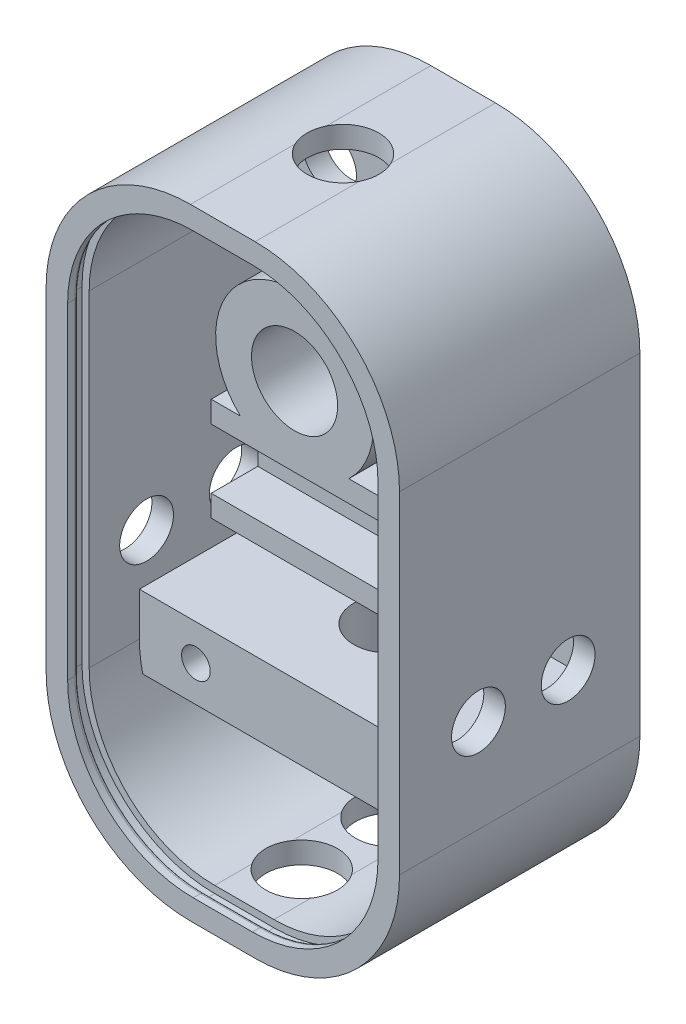
from build123d import *

# Parameters (mm, degrees)
SKIZZE2_W                            = 19.7
SKIZZE2_H                            = 34.6
SKIZZE2_W_2                          = 17.3
SKIZZE2_H_2                          = 32.2
LINEAR_AUSTRAGEN_D_NN1_DEPTH         = 13.4
VERRUNDUNG1_R                        = 7
VERRUNDUNG2_R                        = 8.05
AUFSATZ_LINEAR_START                 = -1.2
AUFSATZ_LINEAR_AUSTRAGEN2_DEPTH      = 1.2
SKIZZE6_R                            = 2
SCHNITT_LINEAR_AUSTRAGEN2_DEPTH      = 2
SKIZZE7_W                            = 18.44
SKIZZE7_H                            = 5.74
SKIZZE7_W_2                          = 16.04
SKIZZE7_H_2                          = 3.34
LINEAR_AUSTRAGEN_D_NN2_DEPTH         = 8.2
SKIZZE8_W                            = 16.04
SKIZZE8_H                            = 3.34
AUFSATZ_LINEAR_AUSTRAGEN3_DEPTH      = 5.6
SKIZZE10_W                           = 13.935
SKIZZE10_H                           = 1.235
SCHNITT_LINEAR_AUSTRAGEN3_DEPTH      = 15.5
SKIZZE11_W                           = 13.935
SKIZZE11_H                           = 1.235
AUFSATZ_LINEAR_AUSTRAGEN4_DEPTH      = 1.2
SKIZZE13_W                           = 17.3
SKIZZE13_H                           = 4
AUFSATZ_LINEAR_AUSTRAGEN6_DEPTH      = 8.2
SKIZZE14_R                           = 0.8
SCHNITT_LINEAR_AUSTRAGEN4_DEPTH      = 8.2
SKIZZE19_R                           = 1.5
SCHNITT_LINEAR_AUSTRAGEN5_DEPTH      = 25.4
SKIZZE20_R                           = 2
SCHNITT_LINEAR_AUSTRAGEN6_DEPTH      = 5.4
SKIZZE21_R                           = 1.5
SCHNITT_LINEAR_AUSTRAGEN7_DEPTH      = 5.4
SKIZZE22_R                           = 1.5
SCHNITT_LINEAR_AUSTRAGEN8_DEPTH      = 5.4
SKIZZE24_R                           = 4.4
SKIZZE24_R_2                         = 2.4
LINEAR_AUSTRAGEN_D_NN3_DEPTH         = 8.2
SKIZZE25_R                           = 2
SCHNITT_LINEAR_AUSTRAGEN9_DEPTH      = 4
VERRUNDUNG3_R                        = 0.6
VERRUNDUNG4_R                        = 0.6
VERRUNDUNG5_R                        = 0.6
SCHNITT_LINEAR_AUSTRAGEN_D_NN1_DEPTH = 1.2
LINEAR_AUSTRAGEN_D_NN4_DEPTH         = 0.6
VERRUNDUNG6_R                        = 0.2
SCHNITT_LINEAR_AUSTRAGEN12_DEPTH     = 6


with BuildPart() as part:
    # Skizze2 → Linear-Austragen-Dünn1 (new body)
    with BuildSketch(Plane.XY):
        with Locations((0, 4.05)):
            Rectangle(SKIZZE2_W, SKIZZE2_H)
        with Locations((0, 4.05)):
            Rectangle(SKIZZE2_W_2, SKIZZE2_H_2, mode=Mode.SUBTRACT)
    extrude(amount=LINEAR_AUSTRAGEN_D_NN1_DEPTH)

    # Verrundung1
    verrundung1_edges = [part.edges().sort_by_distance(p)[0] for p in [
        (8.65, -12.05, 6.7),
        (-8.65, -12.05, 6.7),
        (-8.65, 20.15, 6.7),
        (8.65, 20.15, 6.7),
    ]]
    fillet(verrundung1_edges, radius=VERRUNDUNG1_R)

    # Verrundung2
    verrundung2_edges = [part.edges().sort_by_distance(p)[0] for p in [
        (-9.85, -13.25, 6.7),
        (9.85, -13.25, 6.7),
        (9.85, 21.35, 6.7),
        (-9.85, 21.35, 6.7),
    ]]
    fillet(verrundung2_edges, radius=VERRUNDUNG2_R)

    # Skizze4 → Aufsatz-Linear austragen2 (add)
    with BuildSketch(Plane(origin=(0, 0, 0), x_dir=(-1, 0, 0), z_dir=(0, 0, -1)).offset(AUFSATZ_LINEAR_START)):
        with BuildLine():
            Line((1.65, -12.05), (-1.65, -12.05))
            ThreePointArc((-1.65, -12.05), (-6.599747468, -9.999747468), (-8.65, -5.05))
            Line((-8.65, -5.05), (-8.65, 13.15))
            ThreePointArc((-8.65, 13.15), (-6.599747468, 18.099747468), (-1.65, 20.15))
            Line((-1.65, 20.15), (1.65, 20.15))
            ThreePointArc((1.65, 20.15), (6.599747468, 18.099747468), (8.65, 13.15))
            Line((8.65, 13.15), (8.65, -5.05))
            ThreePointArc((8.65, -5.05), (6.599747468, -9.999747468), (1.65, -12.05))
        make_face()
    extrude(amount=AUFSATZ_LINEAR_AUSTRAGEN2_DEPTH)

    # Skizze6 → Schnitt-Linear austragen2 (cut)
    with BuildSketch(Plane(origin=(0, 21.35, 0), x_dir=(1, 0, 0), z_dir=(0, 1, 0))):
        with Locations((0, -6.7)):
            Circle(SKIZZE6_R)
    extrude(amount=-SCHNITT_LINEAR_AUSTRAGEN2_DEPTH, mode=Mode.SUBTRACT)

    # Skizze7 → Linear-Austragen-Dünn2 (add)
    with BuildSketch(Plane.XY.offset(1.2)):
        with Locations((0, 5.65)):
            Rectangle(SKIZZE7_W, SKIZZE7_H)
        with Locations((0, 5.65)):
            Rectangle(SKIZZE7_W_2, SKIZZE7_H_2, mode=Mode.SUBTRACT)
    extrude(amount=LINEAR_AUSTRAGEN_D_NN2_DEPTH)

    # Skizze8 → Aufsatz-Linear austragen3 (add)
    with BuildSketch(Plane.XY.offset(1.2)):
        with Locations((0, 5.65)):
            Rectangle(SKIZZE8_W, SKIZZE8_H)
    extrude(amount=AUFSATZ_LINEAR_AUSTRAGEN3_DEPTH)

    # Skizze10 → Schnitt-Linear austragen3 (cut)
    with BuildSketch(Plane.XY):
        with Locations((0, 5.65)):
            Rectangle(SKIZZE10_W, SKIZZE10_H)
    extrude(amount=SCHNITT_LINEAR_AUSTRAGEN3_DEPTH, mode=Mode.SUBTRACT)

    # Skizze11 → Aufsatz-Linear austragen4 (add)
    with BuildSketch(Plane(origin=(0, 0, 0), x_dir=(-1, 0, 0), z_dir=(0, 0, -1))):
        with Locations((0, 5.65)):
            Rectangle(SKIZZE11_W, SKIZZE11_H)
    extrude(amount=-AUFSATZ_LINEAR_AUSTRAGEN4_DEPTH)

    # Skizze13 → Aufsatz-Linear austragen6 (add)
    with BuildSketch(Plane.XY.offset(1.2)):
        with Locations((0, -4.65)):
            Rectangle(SKIZZE13_W, SKIZZE13_H)
    extrude(amount=AUFSATZ_LINEAR_AUSTRAGEN6_DEPTH)

    # Skizze14 → Schnitt-Linear austragen4 (cut)
    with BuildSketch(Plane.XY.offset(9.4)):
        with Locations((-5.5, -4.65)):
            Circle(SKIZZE14_R)
        with Locations((5.5, -4.65)):
            Circle(SKIZZE14_R)
    extrude(amount=-SCHNITT_LINEAR_AUSTRAGEN4_DEPTH, mode=Mode.SUBTRACT)

    # Skizze19 → Schnitt-Linear austragen5 (cut)
    with BuildSketch(Plane(origin=(9.85, 0, 0), x_dir=(0, 0, -1), z_dir=(1, 0, 0))):
        with Locations((-4, 0)):
            Circle(SKIZZE19_R)
        with Locations((-9, 0)):
            Circle(SKIZZE19_R)
    extrude(amount=-SCHNITT_LINEAR_AUSTRAGEN5_DEPTH, mode=Mode.SUBTRACT)

    # Skizze20 → Schnitt-Linear austragen6 (cut)
    with BuildSketch(Plane.XZ.offset(13.25)):
        with Locations((0, 4)):
            Circle(SKIZZE20_R)
        with Locations((0, 9)):
            Circle(SKIZZE20_R)
    extrude(amount=-SCHNITT_LINEAR_AUSTRAGEN6_DEPTH, mode=Mode.SUBTRACT)

    # Skizze21 → Schnitt-Linear austragen7 (cut)
    with BuildSketch(Plane.XY.offset(1.2)):
        with Locations((-3.65, 0.18)):
            Circle(SKIZZE21_R)
        with Locations((3.65, 0.18)):
            Circle(SKIZZE21_R)
        with Locations((3.65, -9.05)):
            Circle(SKIZZE21_R)
        with Locations((-3.65, -9.05)):
            Circle(SKIZZE21_R)
    extrude(amount=-SCHNITT_LINEAR_AUSTRAGEN7_DEPTH, mode=Mode.SUBTRACT)

    # Skizze22 → Schnitt-Linear austragen8 (cut)
    with BuildSketch(Plane.XY.offset(1.2)):
        with Locations((-6.25, 15.15)):
            Circle(SKIZZE22_R)
        with Locations((6.25, 15.15)):
            Circle(SKIZZE22_R)
    extrude(amount=-SCHNITT_LINEAR_AUSTRAGEN8_DEPTH, mode=Mode.SUBTRACT)

    # Skizze24 → Linear-Austragen-Dünn3 (add)
    with BuildSketch(Plane.XY.offset(1.2)):
        with Locations((0, 11.72)):
            Circle(SKIZZE24_R)
        with Locations((0, 11.72)):
            Circle(SKIZZE24_R_2, mode=Mode.SUBTRACT)
    extrude(amount=LINEAR_AUSTRAGEN_D_NN3_DEPTH)

    # Skizze25 → Schnitt-Linear austragen9 (cut)
    with BuildSketch(Plane.XZ.offset(6.65)):
        with Locations((0, 4.1)):
            Circle(SKIZZE25_R)
    extrude(amount=-SCHNITT_LINEAR_AUSTRAGEN9_DEPTH, mode=Mode.SUBTRACT)

    # Verrundung3
    verrundung3_edges = [part.edges().sort_by_distance(p)[0] for p in [
        (8.65, 10.835, 1.2),
        (-8.65, 10.835, 1.2),
        (6.599747468, 18.099747468, 1.2),
        (0, 20.15, 1.2),
        (-6.599747468, 18.099747468, 1.2),
    ]]
    fillet(verrundung3_edges, radius=VERRUNDUNG3_R)

    # Verrundung4
    verrundung4_edges = [part.edges().sort_by_distance(p)[0] for p in [
        (8.65, 0.065, 1.2),
        (-8.65, 0.065, 1.2),
    ]]
    fillet(verrundung4_edges, radius=VERRUNDUNG4_R)

    # Verrundung5
    verrundung5_edges = [part.edges().sort_by_distance(p)[0] for p in [
        (-5.997413024, -10.53634669, 1.2),
        (0, -12.05, 1.2),
        (5.997413024, -10.53634669, 1.2),
    ]]
    fillet(verrundung5_edges, radius=VERRUNDUNG5_R)

    # Skizze28 → Schnitt-Linear-Austragen-Dünn1 (cut)
    with BuildSketch(Plane.XY.offset(13.4)):
        with BuildLine():
            Line((-9.05, 13.15), (-9.05, -5.05))
            ThreePointArc((-9.05, -5.05), (-6.882590181, -10.282590181), (-1.65, -12.45))
            Line((-1.65, -12.45), (1.65, -12.45))
            ThreePointArc((1.65, -12.45), (6.882590181, -10.282590181), (9.05, -5.05))
            Line((9.05, -5.05), (9.05, 13.15))
            ThreePointArc((9.05, 13.15), (6.882590181, 18.382590181), (1.65, 20.55))
            Line((1.65, 20.55), (-1.65, 20.55))
            ThreePointArc((-1.65, 20.55), (-6.882590181, 18.382590181), (-9.05, 13.15))
        make_face()
        with BuildLine():
            Line((-8.65, 13.15), (-8.65, -5.05))
            ThreePointArc((-8.65, -5.05), (-6.599747468, -9.999747468), (-1.65, -12.05))
            Line((-1.65, -12.05), (1.65, -12.05))
            ThreePointArc((1.65, -12.05), (6.599747468, -9.999747468), (8.65, -5.05))
            Line((8.65, -5.05), (8.65, 13.15))
            ThreePointArc((8.65, 13.15), (6.599747468, 18.099747468), (1.65, 20.15))
            Line((1.65, 20.15), (-1.65, 20.15))
            ThreePointArc((-1.65, 20.15), (-6.599747468, 18.099747468), (-8.65, 13.15))
        make_face(mode=Mode.SUBTRACT)
    extrude(amount=-SCHNITT_LINEAR_AUSTRAGEN_D_NN1_DEPTH, mode=Mode.SUBTRACT)

    # Skizze31 → Linear-Austragen-Dünn4 (add)
    with BuildSketch(Plane.XY.offset(13.4)):
        with BuildLine():
            Line((-9.05, 13.15), (-9.05, -5.05))
            ThreePointArc((-9.05, -5.05), (-6.882590181, -10.282590181), (-1.65, -12.45))
            Line((-1.65, -12.45), (1.65, -12.45))
            ThreePointArc((1.65, -12.45), (6.882590181, -10.282590181), (9.05, -5.05))
            Line((9.05, -5.05), (9.05, 13.15))
            ThreePointArc((9.05, 13.15), (6.882590181, 18.382590181), (1.65, 20.55))
            Line((1.65, 20.55), (-1.65, 20.55))
            ThreePointArc((-1.65, 20.55), (-6.882590181, 18.382590181), (-9.05, 13.15))
        make_face()
        with BuildLine():
            Line((-8.65, 13.15), (-8.65, -5.05))
            ThreePointArc((-8.65, -5.05), (-6.599747468, -9.999747468), (-1.65, -12.05))
            Line((-1.65, -12.05), (1.65, -12.05))
            ThreePointArc((1.65, -12.05), (6.599747468, -9.999747468), (8.65, -5.05))
            Line((8.65, -5.05), (8.65, 13.15))
            ThreePointArc((8.65, 13.15), (6.599747468, 18.099747468), (1.65, 20.15))
            Line((1.65, 20.15), (-1.65, 20.15))
            ThreePointArc((-1.65, 20.15), (-6.599747468, 18.099747468), (-8.65, 13.15))
        make_face(mode=Mode.SUBTRACT)
    extrude(amount=-LINEAR_AUSTRAGEN_D_NN4_DEPTH)

    # Verrundung6
    verrundung6_edges = [part.edges().sort_by_distance(p)[0] for p in [
        (-6.599747468, 18.099747468, 12.8),
        (-8.65, 4.05, 12.8),
        (-6.599747468, -9.999747468, 12.8),
        (0, -12.05, 12.8),
        (6.599747468, -9.999747468, 12.8),
        (0, 20.15, 12.8),
        (6.599747468, 18.099747468, 12.8),
        (8.65, 4.05, 12.8),
    ]]
    fillet(verrundung6_edges, radius=VERRUNDUNG6_R)

    # Skizze26 → Schnitt-Linear austragen12 (cut)
    with BuildSketch(Plane.XZ.offset(-2.78)):
        with BuildLine():
            ThreePointArc((-8.65, 3.2), (-6.65, 1.2), (-4.65, 3.2))
            Line((-4.65, 3.2), (-4.65, 9.4))
            Line((-4.65, 9.4), (-8.65, 9.4))
            Line((-8.65, 9.4), (-8.65, 3.2))
        make_face()
    extrude(amount=-SCHNITT_LINEAR_AUSTRAGEN12_DEPTH, mode=Mode.SUBTRACT)


solid = part.part
